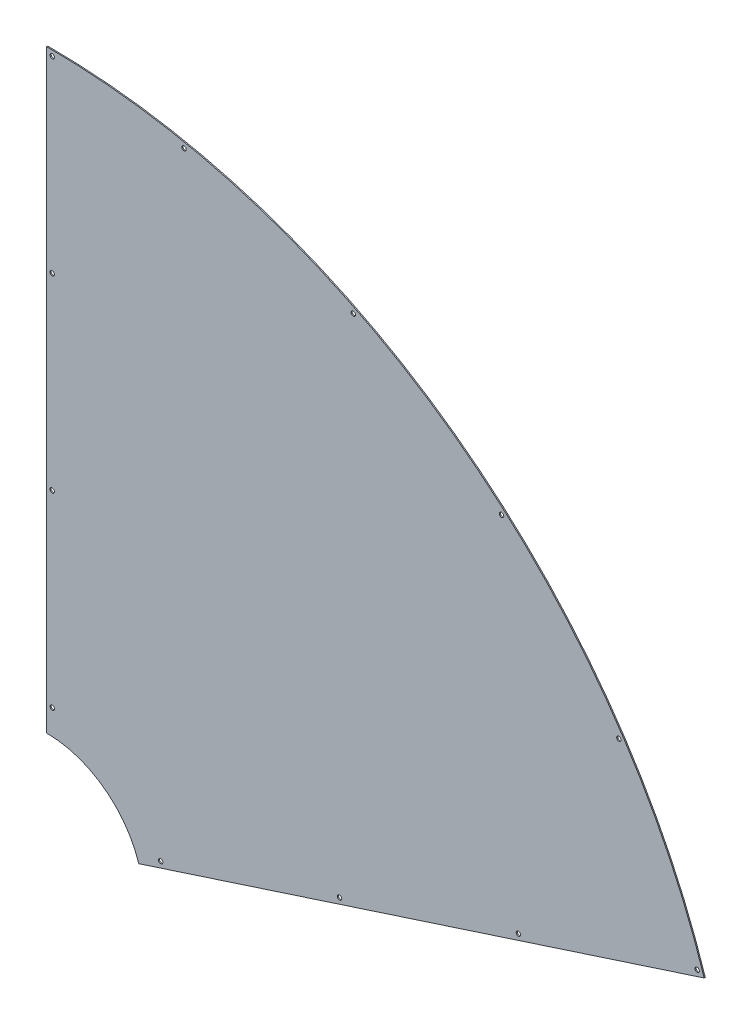
from build123d import *

# Parameters (mm, degrees)
SKETCH1_R             = 4
BOSS_EXTRUDE1_DEPTH   = 2
CIRPATTERN1_OUTLINE_R = 4
CIRPATTERN1_DEPTH     = 2


# Read off the part's stored shape, not the designer's step: CirPattern1
with BuildPart() as part:
    # Sketch1 → Boss-Extrude1 (new body)
    with BuildSketch(Plane.XY):
        with BuildLine():
            Line((0, 1250), (0, 175))
            ThreePointArc((0, 175), (102.995768235, 141.480994221), (166.536499319, 53.764248293))
            Line((166.536499319, 53.764248293), (1188.922508468, 385.957599819))
            ThreePointArc((1188.922508468, 385.957599819), (734.864953657, 1011.17431726), (0, 1250))
        make_face()
        with Locations((206.086847975, 77.543569361)):
            Circle(SKETCH1_R, mode=Mode.SUBTRACT)
        with Locations((529.567521621, 182.234800025)):
            Circle(SKETCH1_R, mode=Mode.SUBTRACT)
        with Locations((852.926737161, 287.300578112)):
            Circle(SKETCH1_R, mode=Mode.SUBTRACT)
        with Locations((10, 219.959676764)):
            Circle(SKETCH1_R, mode=Mode.SUBTRACT)
        with Locations((10, 559.959676764)):
            Circle(SKETCH1_R, mode=Mode.SUBTRACT)
        with Locations((10, 899.959676764)):
            Circle(SKETCH1_R, mode=Mode.SUBTRACT)
        with Locations((10, 1239.959676764)):
            Circle(SKETCH1_R, mode=Mode.SUBTRACT)
        with Locations((1176.285952701, 392.3663562)):
            Circle(SKETCH1_R, mode=Mode.SUBTRACT)
    extrude(amount=BOSS_EXTRUDE1_DEPTH)

    # CirPattern1 outline → CirPattern1 (cut)
    with BuildSketch(Plane.XY):
        with Locations((248.343744291, 1214.876695254)):
            Circle(CIRPATTERN1_OUTLINE_R)
        with Locations((554.314862591, 1109.204684948)):
            Circle(CIRPATTERN1_OUTLINE_R)
        with Locations((822.510339054, 927.94220841)):
            Circle(CIRPATTERN1_OUTLINE_R)
        with Locations((1034.653095173, 683.442003866)):
            Circle(CIRPATTERN1_OUTLINE_R)
    extrude(amount=CIRPATTERN1_DEPTH, mode=Mode.SUBTRACT)


solid = part.part
